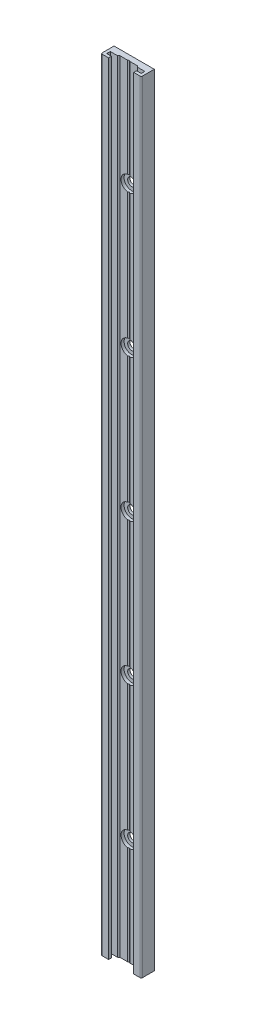
from build123d import *

# Parameters (mm, degrees)
BOSS_EXTRUDE1_DEPTH = 330
CUT_EXTRUDE1_DEPTH  = 331.155266504
LPATTERN1_COUNT     = 5
LPATTERN1_PITCH     = 60


with BuildPart() as part:
    # Sketch1 → Boss-Extrude1 (new body)
    with BuildSketch(Plane(origin=(0, 165, 0), x_dir=(1, 0, 0), z_dir=(0, 1, 0))):
        with BuildLine():
            Line((-8, -5.5), (8, -5.5))
            ThreePointArc((8, -5.5), (8.353553391, -5.353553391), (8.5, -5))
            Line((8.5, -5), (8.5, 0))
            Line((8.5, 0), (-8.5, 0))
            Line((-8.5, 0), (-8.5, -5))
            ThreePointArc((-8.5, -5), (-8.353553391, -5.353553391), (-8, -5.5))
        make_face()
    extrude(amount=-BOSS_EXTRUDE1_DEPTH)

    # Sketch2 → Cut-Extrude1 (cut, through all)
    with BuildSketch(Plane.XZ.offset(165)):
        Polygon((5.3, 5.5), (-5.3, 5.5), (-5.3, 4.3), (-7.3, 4.3), (-7.3, 2.8), (-4.25, 2.8), (-3.75, 2.3), (-0.5, 2.3), (-2e-09, 2.011324867), (0.5, 2.3), (3.75, 2.3), (4.25, 2.8), (7.3, 2.8), (7.3, 4.3), (5.3, 4.3), align=None)
    extrude(amount=-CUT_EXTRUDE1_DEPTH, mode=Mode.SUBTRACT)

    # Sketch3 → Cut-Revolve1 (revolve, cut)
    with BuildSketch(Plane(origin=(0, 120, 0), x_dir=(1, 0, 0), z_dir=(0, 1, 0))):
        Polygon((1.75, 0), (0, 0), (0, -2.3), (3.25, -2.3), (3.25, -1), (1.75, -1), align=None)
    cut_revolve1 = revolve(axis=Axis((0, 120, 0), (0, 0, 1)), mode=Mode.SUBTRACT)

    # LPattern1: Cut-Revolve1 ×5
    with Locations(*[(0, -i * LPATTERN1_PITCH, 0) for i in range(1, LPATTERN1_COUNT)]):
        add(cut_revolve1, mode=Mode.SUBTRACT)


solid = part.part
